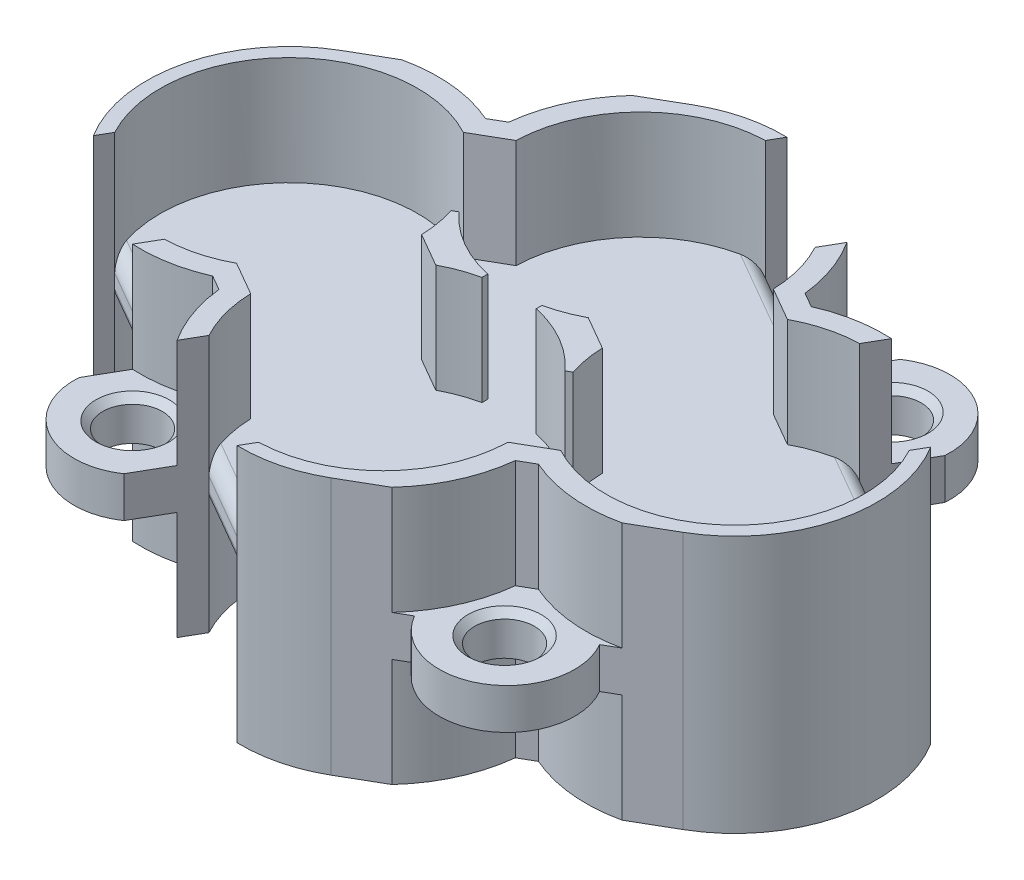
from build123d import *

# Parameters (mm, degrees)
SKETCH1_R                = 9.5
BOSS_EXTRUDE1_DEPTH      = 3
SKETCH1_4_R              = 9.5
BOSS_EXTRUDE2_DEPTH      = 3
BOSS_EXTRUDE3_START      = 8
BOSS_EXTRUDE3_DEPTH      = 19
BOSS_EXTRUDE4_DEPTH      = 3
CUT_EXTRUDE1_REACH       = 37.321
SKETCH4_R                = 2.2
CHAMFER1_SIZE            = 0.5
CHAMFER1_OF_MIRROR1_SIZE = 0.5
CUT_EXTRUDE2_REACH       = 40.569
FILLET1_R                = 1
BOSS_EXTRUDE5_DEPTH      = 8
BOSS_EXTRUDE5_DEPTH_BACK = 11


with BuildPart() as part:
    # Sketch1 → Boss-Extrude1 (new body)
    with BuildSketch(Plane(origin=(0, 0, 0), x_dir=(1, 0, 0), z_dir=(0, 1, 0))):
        with BuildLine():
            Line((-5.25, 18.59326674), (-21.704482672, 9.09326674))
            ThreePointArc((-21.704482672, 9.09326674), (-26.954482672, 0), (-21.704482672, -9.09326674))
            Line((-21.704482672, -9.09326674), (-5.25, -18.59326674))
            ThreePointArc((-5.25, -18.59326674), (0, -20), (5.25, -18.59326674))
            Line((5.25, -18.59326674), (21.704482672, -9.09326674))
            ThreePointArc((21.704482672, -9.09326674), (26.954482672, 0), (21.704482672, 9.09326674))
            Line((21.704482672, 9.09326674), (5.25, 18.59326674))
            ThreePointArc((5.25, 18.59326674), (0, 20), (-5.25, 18.59326674))
        make_face()
        with Locations(Location((0, -9.5, 0), (0, 0, 90))):
            Circle(SKETCH1_R, mode=Mode.SUBTRACT)
    extrude(amount=-BOSS_EXTRUDE1_DEPTH)

    # Sketch1<4> → Boss-Extrude2 (add)
    with BuildSketch(Plane(origin=(0, 0, 0), x_dir=(1, 0, 0), z_dir=(0, 1, 0))):
        with Locations((0, 9.5)):
            Circle(SKETCH1_4_R)
        with Locations((0, -9.5)):
            Circle(SKETCH1_4_R)
    extrude(amount=-BOSS_EXTRUDE2_DEPTH)

    # Sketch1<6> → Boss-Extrude3 (add)
    with BuildSketch(Plane(origin=(0, 0, 0), x_dir=(1, 0, 0), z_dir=(0, 1, 0)).offset(BOSS_EXTRUDE3_START)):
        with BuildLine():
            ThreePointArc((-11.958948382, -8.369000624), (-25.954482672, 0), (-11.958948382, 8.369000624))
            Line((-11.958948382, 8.369000624), (-9.49553429, 9.791253414))
            ThreePointArc((-9.49553429, 9.791253414), (-6.613739206, 16.319710677), (0, 19))
            Line((0, 19), (0, 20))
            ThreePointArc((0, 20), (-2.717599974, 19.642221176), (-5.25, 18.59326674))
            Line((-5.25, 18.59326674), (-8.089454173, 16.953907109))
            ThreePointArc((-8.089454173, 16.953907109), (-10.01434129, 14.051150241), (-10.935213074, 10.692105287))
            ThreePointArc((-10.935213074, 10.692105287), (-10.982339992, 10.123063642), (-10.999875463, 9.552343178))
            ThreePointArc((-10.999875463, 9.552343178), (-11.502901618, 9.822517247), (-12.019269597, 10.066224962))
            ThreePointArc((-12.019269597, 10.066224962), (-15.388723752, 10.94824908), (-18.865028499, 10.732626371))
            Line((-18.865028499, 10.732626371), (-21.704482672, 9.09326674))
            ThreePointArc((-21.704482672, 9.09326674), (-26.954482672, 0), (-21.704482672, -9.09326674))
            Line((-21.704482672, -9.09326674), (-18.865028499, -10.732626371))
            ThreePointArc((-18.865028499, -10.732626371), (-15.388723752, -10.94824908), (-12.019269597, -10.066224962))
            ThreePointArc((-12.019269597, -10.066224962), (-11.502901618, -9.822517247), (-10.999875463, -9.552343178))
            ThreePointArc((-10.999875463, -9.552343178), (-10.982339992, -10.123063642), (-10.935213074, -10.692105287))
            ThreePointArc((-10.935213074, -10.692105287), (-10.01434129, -14.051150241), (-8.089454173, -16.953907109))
            Line((-8.089454173, -16.953907109), (-5.25, -18.59326674))
            ThreePointArc((-5.25, -18.59326674), (-2.717599974, -19.642221176), (0, -20))
            Line((0, -20), (0, -19))
            ThreePointArc((0, -19), (-6.613739206, -16.319710677), (-9.49553429, -9.791253414))
            Line((-9.49553429, -9.791253414), (-11.958948382, -8.369000624))
        make_face()
        with BuildLine():
            ThreePointArc((-10.999875463, 9.552343178), (-10.982339992, 10.123063642), (-10.935213074, 10.692105287))
            Line((-10.935213074, 10.692105287), (-12.019269597, 10.066224962))
            ThreePointArc((-12.019269597, 10.066224962), (-11.502901618, 9.822517247), (-10.999875463, 9.552343178))
        make_face()
        with BuildLine():
            Line((-12.019269597, -10.066224962), (-10.935213074, -10.692105287))
            ThreePointArc((-10.935213074, -10.692105287), (-10.982339992, -10.123063642), (-10.999875463, -9.552343178))
            ThreePointArc((-10.999875463, -9.552343178), (-11.502901618, -9.822517247), (-12.019269597, -10.066224962))
        make_face()
    boss_extrude3 = extrude(amount=-BOSS_EXTRUDE3_DEPTH)

    # Sketch3 → Boss-Extrude4 (add)
    with BuildSketch(Plane(origin=(0, 0, 0), x_dir=(1, 0, 0), z_dir=(0, 1, 0))):
        with BuildLine():
            Line((-17.807368355, -11.34326674), (-9.147114317, -16.34326674))
            ThreePointArc((-9.147114317, -16.34326674), (-15.977241336, -18.173393759), (-17.807368355, -11.34326674))
        make_face()
        with BuildLine():
            Line((-17.807368355, 11.34326674), (-9.147114317, 16.34326674))
            ThreePointArc((-9.147114317, 16.34326674), (-15.977241336, 18.173393759), (-17.807368355, 11.34326674))
        make_face()
    boss_extrude4 = extrude(amount=-BOSS_EXTRUDE4_DEPTH)

    # Sketch4 → Cut-Extrude1 (cut, up to next)
    with BuildSketch(Plane(origin=(0, 0, 0), x_dir=(1, 0, 0), z_dir=(0, 1, 0)), mode=Mode.PRIVATE) as cut_extrude1_sk1:
        with Locations(Location((-13.727241336, -14.276279442, 0), (0, 0, 270))):
            Circle(SKETCH4_R)
    cut_extrude1_tool1 = extrude(cut_extrude1_sk1.sketch, amount=-CUT_EXTRUDE1_REACH, mode=Mode.PRIVATE) & part.part
    # Sketch4 → Cut-Extrude1 (cut, up to next)
    with BuildSketch(Plane(origin=(0, 0, 0), x_dir=(1, 0, 0), z_dir=(0, 1, 0)), mode=Mode.PRIVATE) as cut_extrude1_sk2:
        with Locations(Location((-13.727241336, 14.276279442, 0), (0, 0, 270))):
            Circle(SKETCH4_R)
    cut_extrude1_tool2 = extrude(cut_extrude1_sk2.sketch, amount=-CUT_EXTRUDE1_REACH, mode=Mode.PRIVATE) & part.part
    cut_extrude1_1 = cut_extrude1_tool1.solids().sort_by_distance((-13.727241, 0, 14.276279))[0]
    add(cut_extrude1_1, mode=Mode.SUBTRACT)
    cut_extrude1_2 = cut_extrude1_tool2.solids().sort_by_distance((-13.727241, 0, -14.276279))[0]
    add(cut_extrude1_2, mode=Mode.SUBTRACT)
    cut_extrude1 = cut_extrude1_1 + cut_extrude1_2  # Cut-Extrude1 as one shape, for the pattern or mirror that repeats it

    # Chamfer1
    chamfer1_edges = [part.edges().sort_by_distance(p)[0] for p in [
        (-13.727241336, 0, -16.476279442),
        (-13.727241336, 0, 12.076279442),
    ]]
    chamfer(chamfer1_edges, length=CHAMFER1_SIZE)

    # Mirror1: Boss-Extrude3, Boss-Extrude4, Cut-Extrude1 across plane
    add(boss_extrude3.mirror(Plane(origin=(0, 0, 0), x_dir=(0, 0, 1), z_dir=(1, 0, 0))))
    add(boss_extrude4.mirror(Plane(origin=(0, 0, 0), x_dir=(0, 0, 1), z_dir=(1, 0, 0))))
    add(cut_extrude1.mirror(Plane(origin=(0, 0, 0), x_dir=(0, 0, 1), z_dir=(1, 0, 0))), mode=Mode.SUBTRACT)

    # Chamfer1 of Mirror1
    chamfer1_of_mirror1_edges = [part.edges().sort_by_distance(p)[0] for p in [
        (13.727241336, 0, -16.476279442),
        (13.727241336, 0, 12.076279442),
    ]]
    chamfer(chamfer1_of_mirror1_edges, length=CHAMFER1_OF_MIRROR1_SIZE)

    # Sketch5 → Cut-Extrude2 (cut, up to next)
    with BuildSketch(Plane(origin=(0, 8, 0), x_dir=(1, 0, 0), z_dir=(0, 1, 0)), mode=Mode.PRIVATE) as cut_extrude2_sk1:
        Polygon((-24.823483296, -4.49553429), (-16.163229258, -9.49553429), (-18.464080389, -13.480725349), (-27.124334427, -8.480725349), align=None)
    cut_extrude2_tool1 = extrude(cut_extrude2_sk1.sketch, amount=-CUT_EXTRUDE2_REACH, mode=Mode.PRIVATE) & part.part
    # Sketch5 → Cut-Extrude2 (cut, up to next)
    with BuildSketch(Plane(origin=(0, 8, 0), x_dir=(1, 0, 0), z_dir=(0, 1, 0)), mode=Mode.PRIVATE) as cut_extrude2_sk2:
        Polygon((-8.369000624, -13.99553429), (0.291253414, -18.99553429), (-2.009597717, -22.980725349), (-10.669851755, -17.980725349), align=None)
    cut_extrude2_tool2 = extrude(cut_extrude2_sk2.sketch, amount=-CUT_EXTRUDE2_REACH, mode=Mode.PRIVATE) & part.part
    # Sketch5 → Cut-Extrude2 (cut, up to next)
    with BuildSketch(Plane(origin=(0, 8, 0), x_dir=(1, 0, 0), z_dir=(0, 1, 0)), mode=Mode.PRIVATE) as cut_extrude2_sk3:
        Polygon((-0.291253414, 18.99553429), (8.369000624, 13.99553429), (10.669851755, 17.980725349), (2.009597717, 22.980725349), align=None)
    cut_extrude2_tool3 = extrude(cut_extrude2_sk3.sketch, amount=-CUT_EXTRUDE2_REACH, mode=Mode.PRIVATE) & part.part
    # Sketch5 → Cut-Extrude2 (cut, up to next)
    with BuildSketch(Plane(origin=(0, 8, 0), x_dir=(1, 0, 0), z_dir=(0, 1, 0)), mode=Mode.PRIVATE) as cut_extrude2_sk4:
        Polygon((16.163229258, 9.49553429), (24.823483296, 4.49553429), (27.124334427, 8.480725349), (18.464080389, 13.480725349), align=None)
    cut_extrude2_tool4 = extrude(cut_extrude2_sk4.sketch, amount=-CUT_EXTRUDE2_REACH, mode=Mode.PRIVATE) & part.part
    add(cut_extrude2_tool1.solids().sort_by_distance((-21.643782, 8, 8.98813))[0], mode=Mode.SUBTRACT)
    add(cut_extrude2_tool2.solids().sort_by_distance((-5.189299, 8, 18.48813))[0], mode=Mode.SUBTRACT)
    add(cut_extrude2_tool3.solids().sort_by_distance((5.189299, 8, -18.48813))[0], mode=Mode.SUBTRACT)
    add(cut_extrude2_tool4.solids().sort_by_distance((21.643782, 8, -8.98813))[0], mode=Mode.SUBTRACT)

    # Fillet1
    # the kernel refuses this fillet: 1 mm, written as the material it takes off along each edge
    with BuildSketch(Plane(origin=(-13.998165749, 0, 10.74553429), x_dir=(0.49999999999999956, 0, -0.866025403784439), z_dir=(-0.8660254037844389, 0, -0.4999999999999995))) as fillet1_piece_1_section:
        with BuildLine():
            CenterArc((FILLET1_R, FILLET1_R), FILLET1_R, 180, 90)
            Line((0, FILLET1_R), (0, 0))
            Line((0, 0), (FILLET1_R, 0))
        make_face()
    fillet1_piece_1 = extrude(amount=15, mode=Mode.PRIVATE)
    fillet1_piece_1 = fillet1_piece_1 & Plane(origin=(-16.454482672, -0.134031424, 0), x_dir=(0.47321413577016985, 0, 0.8809474341340074), z_dir=(0, 1, 0)) * Cylinder(9.5, 34, mode=Mode.PRIVATE)
    add(fillet1_piece_1, mode=Mode.SUBTRACT)
    with BuildSketch(Plane(origin=(-13.998165749, -3, 10.74553429), x_dir=(0.49999999999999956, 0, -0.866025403784439), z_dir=(-0.8660254037844389, 0, -0.4999999999999995))) as fillet1_piece_2_section:
        with BuildLine():
            CenterArc((FILLET1_R, -FILLET1_R), FILLET1_R, 90, 90)
            Line((0, -FILLET1_R), (0, 0))
            Line((0, 0), (FILLET1_R, 0))
        make_face()
    fillet1_piece_2 = extrude(amount=15, mode=Mode.PRIVATE)
    fillet1_piece_2 = fillet1_piece_2 & Plane(origin=(-16.454482672, -2.865968576, 0), x_dir=(0.47321413577016985, 0, 0.8809474341340074), z_dir=(0, 1, 0)) * Cylinder(9.5, 34, mode=Mode.PRIVATE)
    add(fillet1_piece_2, mode=Mode.SUBTRACT)
    with BuildSketch(Plane(origin=(2.456316923, 0, 20.24553429), x_dir=(0, -1, 0), z_dir=(-0.8660254037844387, 0, -0.5000000000000001))) as fillet1_piece_3_section:
        with BuildLine():
            CenterArc((FILLET1_R, -FILLET1_R), FILLET1_R, 90, 90)
            Line((0, -FILLET1_R), (0, 0))
            Line((0, 0), (FILLET1_R, 0))
        make_face()
    fillet1_piece_3 = extrude(amount=15, mode=Mode.PRIVATE)
    fillet1_piece_3 = fillet1_piece_3 & Plane(origin=(0, -0.134033737, 9.5), x_dir=(0, 0, 1), z_dir=(0, 1, 0)) * Cylinder(9.5, 35, mode=Mode.PRIVATE)
    add(fillet1_piece_3, mode=Mode.SUBTRACT)
    with BuildSketch(Plane(origin=(2.456316923, -3, 20.24553429), x_dir=(0, 1, 0), z_dir=(-0.8660254037844387, 0, -0.5000000000000001))) as fillet1_piece_4_section:
        with BuildLine():
            CenterArc((FILLET1_R, FILLET1_R), FILLET1_R, 180, 90)
            Line((0, FILLET1_R), (0, 0))
            Line((0, 0), (FILLET1_R, 0))
        make_face()
    fillet1_piece_4 = extrude(amount=15, mode=Mode.PRIVATE)
    fillet1_piece_4 = fillet1_piece_4 & Plane(origin=(0, -2.865966263, 9.5), x_dir=(0, 0, 1), z_dir=(0, 1, 0)) * Cylinder(9.5, 35, mode=Mode.PRIVATE)
    add(fillet1_piece_4, mode=Mode.SUBTRACT)
    with BuildSketch(Plane(origin=(10.534064134, 0, -12.74553429), x_dir=(-0.4999999999999997, 0, 0.8660254037844389), z_dir=(-0.8660254037844388, 0, -0.49999999999999967))) as fillet1_piece_5_section:
        with BuildLine():
            CenterArc((FILLET1_R, -FILLET1_R), FILLET1_R, 90, 90)
            Line((0, -FILLET1_R), (0, 0))
            Line((0, 0), (FILLET1_R, 0))
        make_face()
    fillet1_piece_5 = extrude(amount=15, mode=Mode.PRIVATE)
    fillet1_piece_5 = fillet1_piece_5 & Plane(origin=(0, -0.134037096, -9.5), x_dir=(-0.9995299252438539, 0, -0.030658254060138262), z_dir=(0, 1, 0)) * Cylinder(9.5, 35, mode=Mode.PRIVATE)
    add(fillet1_piece_5, mode=Mode.SUBTRACT)
    with BuildSketch(Plane(origin=(10.534064134, -3, -12.74553429), x_dir=(-0.4999999999999997, 0, 0.8660254037844389), z_dir=(-0.8660254037844388, 0, -0.49999999999999967))) as fillet1_piece_6_section:
        with BuildLine():
            CenterArc((FILLET1_R, FILLET1_R), FILLET1_R, 180, 90)
            Line((0, FILLET1_R), (0, 0))
            Line((0, 0), (FILLET1_R, 0))
        make_face()
    fillet1_piece_6 = extrude(amount=15, mode=Mode.PRIVATE)
    fillet1_piece_6 = fillet1_piece_6 & Plane(origin=(0, -2.865962904, -9.5), x_dir=(-0.9995299252438539, 0, -0.030658254060138262), z_dir=(0, 1, 0)) * Cylinder(9.5, 35, mode=Mode.PRIVATE)
    add(fillet1_piece_6, mode=Mode.SUBTRACT)
    with BuildSketch(Plane(origin=(26.988546806, 0, -3.24553429), x_dir=(-0.4999999999999998, 0, 0.8660254037844387), z_dir=(-0.8660254037844388, 0, -0.49999999999999983))) as fillet1_piece_7_section:
        with BuildLine():
            CenterArc((FILLET1_R, -FILLET1_R), FILLET1_R, 90, 90)
            Line((0, -FILLET1_R), (0, 0))
            Line((0, 0), (FILLET1_R, 0))
        make_face()
    fillet1_piece_7 = extrude(amount=15, mode=Mode.PRIVATE)
    fillet1_piece_7 = fillet1_piece_7 & Plane(origin=(16.454482672, -0.134031424, 0), x_dir=(-0.47321413577016985, 0, 0.8809474341340074), z_dir=(0, 1, 0)) * Cylinder(9.5, 34, mode=Mode.PRIVATE)
    add(fillet1_piece_7, mode=Mode.SUBTRACT)
    with BuildSketch(Plane(origin=(26.988546806, -3, -3.24553429), x_dir=(0, 1, 0), z_dir=(-0.8660254037844388, 0, -0.49999999999999983))) as fillet1_piece_8_section:
        with BuildLine():
            CenterArc((FILLET1_R, -FILLET1_R), FILLET1_R, 90, 90)
            Line((0, -FILLET1_R), (0, 0))
            Line((0, 0), (FILLET1_R, 0))
        make_face()
    fillet1_piece_8 = extrude(amount=15, mode=Mode.PRIVATE)
    fillet1_piece_8 = fillet1_piece_8 & Plane(origin=(16.454482672, -2.865966111, 0), x_dir=(-0.47321413577016985, 0, 0.8809474341340074), z_dir=(0, 1, 0)) * Cylinder(9.5, 34, mode=Mode.PRIVATE)
    add(fillet1_piece_8, mode=Mode.SUBTRACT)

    # Sketch6 → Boss-Extrude5 (add, two sides: drawn at the far end of the back side and taken through both)
    with BuildSketch(Plane(origin=(0, 0, 0), x_dir=(1, 0, 0), z_dir=(0, 1, 0)).offset(-BOSS_EXTRUDE5_DEPTH_BACK)):
        with BuildLine():
            ThreePointArc((-7.411628701, 2.911493098), (-7.093159377, 1.617289761), (-6.958948382, 0.291253414))
            Line((-6.958948382, 0.291253414), (-4.49553429, -1.130999376))
            ThreePointArc((-4.49553429, -1.130999376), (-3.280047629, -0.584211333), (-2, -0.212912189))
            Line((-2, -0.212912189), (-2, 0.212912189))
            ThreePointArc((-2, 0.212912189), (-4.75, 1.272758664), (-7.042853971, 3.124405287))
            Line((-7.042853971, 3.124405287), (-7.411628701, 2.911493098))
        make_face()
        with BuildLine():
            ThreePointArc((4.49553429, 1.130999376), (3.280047629, 0.584211333), (2, 0.212912189))
            Line((2, 0.212912189), (2, -0.212912189))
            ThreePointArc((2, -0.212912189), (4.75, -1.272758664), (7.042853971, -3.124405287))
            Line((7.042853971, -3.124405287), (7.411628701, -2.911493098))
            ThreePointArc((7.411628701, -2.911493098), (7.093159377, -1.617289761), (6.958948382, -0.291253414))
            Line((6.958948382, -0.291253414), (4.49553429, 1.130999376))
        make_face()
    extrude(amount=BOSS_EXTRUDE5_DEPTH + BOSS_EXTRUDE5_DEPTH_BACK)


solid = part.part
